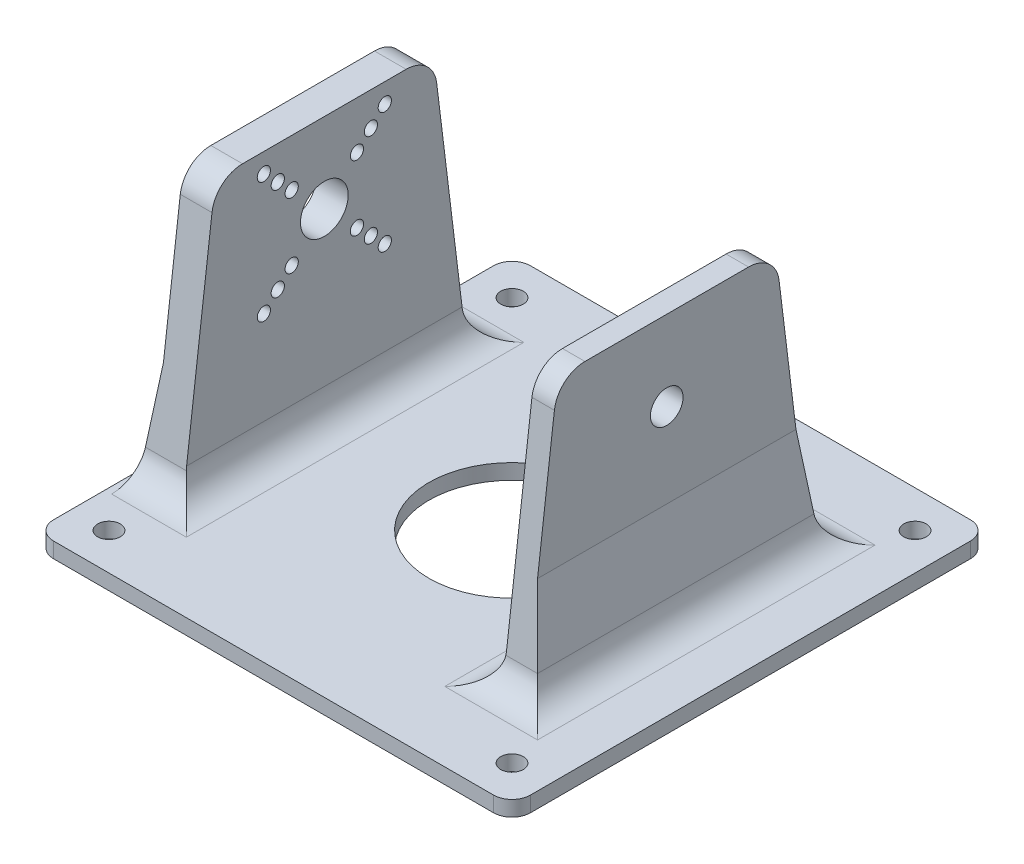
from build123d import *

# Parameters (mm, degrees)
SKETCH1_W           = 77.5
SKETCH1_H           = 77.5
SKETCH1_R           = 1.83
SKETCH1_R_2         = 13.5
BOSS_EXTRUDE1_DEPTH = 2.5
FILLET1_R           = 3
SKETCH2_W           = 5.15
SKETCH2_H           = 32
SKETCH2_W_2         = 3.65
BOSS_EXTRUDE2_DEPTH = 43
SKETCH3_R           = 3.875
SKETCH3_R_2         = 1.075
CUT_EXTRUDE1_DEPTH  = 10
SKETCH4_R           = 2.65
CUT_EXTRUDE2_DEPTH  = 10
SKETCH5_R           = 3.875
SKETCH5_R_2         = 2.65
BOSS_EXTRUDE3_DEPTH = 1.5
CHAMFER1_SIZE       = 1.5
CHAMFER2_SIZE       = 57.010424996
CHAMFER2_SIZE_2     = 7
CHAMFER3_SIZE       = 2
CHAMFER3_SIZE2      = 16.288692856
FILLET2_R           = 5


# Some blends are built 0.0001 mm under size
with BuildPart() as part:
    # Sketch1 → Boss-Extrude1 (new body)
    with BuildSketch(Plane(origin=(0, 0, 0), x_dir=(1, 0, 0), z_dir=(0, 1, 0))):
        Rectangle(SKETCH1_W, SKETCH1_H)
        with Locations(Location((32.75, 32.75, 0), (0, 0, 270))):
            Circle(SKETCH1_R, mode=Mode.SUBTRACT)
        with Locations(Location((32.75, -32.75, 0), (0, 0, 270))):
            Circle(SKETCH1_R, mode=Mode.SUBTRACT)
        with Locations(Location((-32.75, -32.75, 0), (0, 0, 270))):
            Circle(SKETCH1_R, mode=Mode.SUBTRACT)
        with Locations(Location((-32.75, 32.75, 0), (0, 0, 270))):
            Circle(SKETCH1_R, mode=Mode.SUBTRACT)
        with Locations(Location((0, 0, 0), (0, 0, 270))):
            Circle(SKETCH1_R_2, mode=Mode.SUBTRACT)
    extrude(amount=BOSS_EXTRUDE1_DEPTH)

    # Fillet1
    fillet1_edges = [part.edges().sort_by_distance(p)[0] for p in [
        (38.75, 1.25, 38.75),
        (-38.75, 1.25, 38.75),
        (-38.75, 1.25, -38.75),
        (38.75, 1.25, -38.75),
    ]]
    fillet(fillet1_edges, radius=FILLET1_R)

    # Sketch2 → Boss-Extrude2 (add)
    with BuildSketch(Plane(origin=(0, 2.5, 0), x_dir=(1, 0, 0), z_dir=(0, 1, 0))):
        with Locations((-33.075, 0)):
            Rectangle(SKETCH2_W, SKETCH2_H)
        with Locations((23.325, 0)):
            Rectangle(SKETCH2_W_2, SKETCH2_H)
    extrude(amount=BOSS_EXTRUDE2_DEPTH)

    # Sketch3 → Cut-Extrude1 (cut)
    with BuildSketch(Plane.ZY.offset(35.65)):
        with Locations((0, 32.5)):
            Circle(SKETCH3_R)
        with Locations((-5.303300859, 37.803300859)):
            Circle(SKETCH3_R_2)
        with Locations((5.303300859, 37.803300859)):
            Circle(SKETCH3_R_2)
        with Locations((5.303300859, 27.196699141)):
            Circle(SKETCH3_R_2)
        with Locations((-5.303300859, 27.196699141)):
            Circle(SKETCH3_R_2)
        with Locations((-7.566042559, 40.066042559)):
            Circle(SKETCH3_R_2)
        with Locations((-9.828784258, 42.328784258)):
            Circle(SKETCH3_R_2)
        with Locations((9.828784258, 42.328784258)):
            Circle(SKETCH3_R_2)
        with Locations((7.566042559, 40.066042559)):
            Circle(SKETCH3_R_2)
        with Locations((9.828784258, 22.671215742)):
            Circle(SKETCH3_R_2)
        with Locations((7.566042559, 24.933957441)):
            Circle(SKETCH3_R_2)
        with Locations((-9.828784258, 22.671215742)):
            Circle(SKETCH3_R_2)
        with Locations((-7.566042559, 24.933957441)):
            Circle(SKETCH3_R_2)
    extrude(amount=-CUT_EXTRUDE1_DEPTH, mode=Mode.SUBTRACT)

    # Sketch4 → Cut-Extrude2 (cut)
    with BuildSketch(Plane(origin=(25.15, 0, 0), x_dir=(0, 0, -1), z_dir=(1, 0, 0))):
        with Locations((0, 32.5)):
            Circle(SKETCH4_R)
    extrude(amount=-CUT_EXTRUDE2_DEPTH, mode=Mode.SUBTRACT)

    # Sketch5 → Boss-Extrude3 (add)
    with BuildSketch(Plane.ZY.offset(-21.5)):
        with Locations((0, 32.5)):
            Circle(SKETCH5_R)
        with Locations(Location((0, 32.5, 0), (0, 0, 180))):
            Circle(SKETCH5_R_2, mode=Mode.SUBTRACT)
    extrude(amount=BOSS_EXTRUDE3_DEPTH)

    # Chamfer1
    chamfer1_edges = [part.edges().sort_by_distance(p)[0] for p in [
        (21.5, 32.5, -3.875),
    ]]
    chamfer(chamfer1_edges, length=CHAMFER1_SIZE - 0.0001)  # a hair under: the kernel refuses the full size

    # Chamfer2
    # the kernel refuses this chamfer: 57.010424996, 7 mm, written as the material it adds along each edge
    with BuildSketch(Plane(origin=(25.15, 2.5, 16), x_dir=(0, 0.9999890085715016, -0.004688575069790725), z_dir=(-1, 0, 0))) as chamfer2_piece_1_section:
        Polygon((CHAMFER2_SIZE * 0.999989008568, -CHAMFER2_SIZE * 0.00468857506978), (-CHAMFER2_SIZE_2 * 0.00468857506979, -CHAMFER2_SIZE_2 * 0.999989008572), (0, 0), align=None)
    chamfer2_piece_1 = extrude(amount=3.65, mode=Mode.PRIVATE)
    chamfer2_piece_1 = split(chamfer2_piece_1, bisect_by=Plane(origin=(23.325, 45.5, 17.927649929), z_dir=(0, -1, 0)), keep=Keep.TOP, mode=Mode.PRIVATE)
    add(chamfer2_piece_1)
    with BuildSketch(Plane(origin=(25.15, 2.5, 16), x_dir=(0, 0.9999890085715016, -0.004688575069790725), z_dir=(-1, 0, 0))) as chamfer2_piece_2_section:
        Polygon((CHAMFER2_SIZE * 0.999989008568, -CHAMFER2_SIZE * 0.00468857506978), (-CHAMFER2_SIZE_2 * 0.00468857506979, -CHAMFER2_SIZE_2 * 0.999989008572), (0, 0), align=None)
    chamfer2_piece_2 = extrude(amount=151.836239061, mode=Mode.PRIVATE)
    chamfer2_piece_2 = split(chamfer2_piece_2, bisect_by=Plane(origin=(-33.075, 45.5, 17.927649929), z_dir=(0, -1, 0)), keep=Keep.TOP, mode=Mode.PRIVATE)
    chamfer2_piece_2 = split(chamfer2_piece_2, bisect_by=Plane(origin=(-35.65, 19.754331074, 17.927649929), z_dir=(1, 0, 0)), keep=Keep.TOP, mode=Mode.PRIVATE)
    chamfer2_piece_2 = split(chamfer2_piece_2, bisect_by=Plane(origin=(-30.5, 19.754331074, 17.927649929), z_dir=(-1, 0, 0)), keep=Keep.TOP, mode=Mode.PRIVATE)
    add(chamfer2_piece_2)
    with BuildSketch(Plane(origin=(117.686239061, 2.5, 16), x_dir=(0, -0.29696840376136574, 0.9548873060039212), z_dir=(-1, 0, 0))) as chamfer2_piece_3_section:
        Polygon((CHAMFER2_SIZE_2 * 0.954887306004, CHAMFER2_SIZE_2 * 0.296968403761), (-CHAMFER2_SIZE * 0.29696840376, CHAMFER2_SIZE * 0.954887306001), (0, 0), align=None)
    chamfer2_piece_3 = extrude(amount=153.336239061, mode=Mode.PRIVATE)
    chamfer2_piece_3 = split(chamfer2_piece_3, bisect_by=Plane(origin=(21.5, 19.754331074, 17.927649929), z_dir=(1, 0, 0)), keep=Keep.TOP, mode=Mode.PRIVATE)
    chamfer2_piece_3 = split(chamfer2_piece_3, bisect_by=Plane(origin=(25.15, 19.754331074, 17.927649929), z_dir=(-1, 0, 0)), keep=Keep.TOP, mode=Mode.PRIVATE)
    chamfer2_piece_3 = split(chamfer2_piece_3, bisect_by=Plane(origin=(23.325, 45.5, 17.927649929), z_dir=(0, -1, 0)), keep=Keep.TOP, mode=Mode.PRIVATE)
    add(chamfer2_piece_3)
    with BuildSketch(Plane(origin=(-30.5, 2.5, 16), x_dir=(0, -0.29696840376136574, 0.9548873060039212), z_dir=(-1, 0, 0))) as chamfer2_piece_4_section:
        Polygon((CHAMFER2_SIZE_2 * 0.954887306004, CHAMFER2_SIZE_2 * 0.296968403761), (-CHAMFER2_SIZE * 0.29696840376, CHAMFER2_SIZE * 0.954887306001), (0, 0), align=None)
    chamfer2_piece_4 = extrude(amount=5.15, mode=Mode.PRIVATE)
    chamfer2_piece_4 = split(chamfer2_piece_4, bisect_by=Plane(origin=(-33.075, 45.5, 17.927649929), z_dir=(0, -1, 0)), keep=Keep.TOP, mode=Mode.PRIVATE)
    add(chamfer2_piece_4)
    with BuildSketch(Plane(origin=(-35.65, 2.5, -16), x_dir=(0, -0.29696840376136574, -0.9548873060039212), z_dir=(1, 0, 0))) as chamfer2_piece_5_section:
        Polygon((CHAMFER2_SIZE_2 * 0.954887306004, CHAMFER2_SIZE_2 * 0.296968403761), (-CHAMFER2_SIZE * 0.29696840376, CHAMFER2_SIZE * 0.954887306001), (0, 0), align=None)
    chamfer2_piece_5 = extrude(amount=5.15, mode=Mode.PRIVATE)
    chamfer2_piece_5 = split(chamfer2_piece_5, bisect_by=Plane(origin=(-33.075, 45.5, -17.927649929), z_dir=(0, -1, 0)), keep=Keep.TOP, mode=Mode.PRIVATE)
    add(chamfer2_piece_5)
    with BuildSketch(Plane(origin=(-35.65, 2.5, -16), x_dir=(0, -0.29696840376136574, -0.9548873060039212), z_dir=(1, 0, 0))) as chamfer2_piece_6_section:
        Polygon((CHAMFER2_SIZE_2 * 0.954887306004, CHAMFER2_SIZE_2 * 0.296968403761), (-CHAMFER2_SIZE * 0.29696840376, CHAMFER2_SIZE * 0.954887306001), (0, 0), align=None)
    chamfer2_piece_6 = extrude(amount=153.336239061, mode=Mode.PRIVATE)
    chamfer2_piece_6 = split(chamfer2_piece_6, bisect_by=Plane(origin=(21.5, 19.754331074, -17.927649929), z_dir=(1, 0, 0)), keep=Keep.TOP, mode=Mode.PRIVATE)
    chamfer2_piece_6 = split(chamfer2_piece_6, bisect_by=Plane(origin=(23.325, 45.5, -17.927649929), z_dir=(0, -1, 0)), keep=Keep.TOP, mode=Mode.PRIVATE)
    chamfer2_piece_6 = split(chamfer2_piece_6, bisect_by=Plane(origin=(25.15, 19.754331074, -17.927649929), z_dir=(-1, 0, 0)), keep=Keep.TOP, mode=Mode.PRIVATE)
    add(chamfer2_piece_6)
    with BuildSketch(Plane(origin=(-126.686239061, 2.5, -16), x_dir=(0, -0.29696840376136574, -0.9548873060039212), z_dir=(1, 0, 0))) as chamfer2_piece_7_section:
        Polygon((CHAMFER2_SIZE_2 * 0.954887306004, CHAMFER2_SIZE_2 * 0.296968403761), (-CHAMFER2_SIZE * 0.29696840376, CHAMFER2_SIZE * 0.954887306001), (0, 0), align=None)
    chamfer2_piece_7 = extrude(amount=151.836239061, mode=Mode.PRIVATE)
    chamfer2_piece_7 = split(chamfer2_piece_7, bisect_by=Plane(origin=(-33.075, 45.5, -17.927649929), z_dir=(0, -1, 0)), keep=Keep.TOP, mode=Mode.PRIVATE)
    chamfer2_piece_7 = split(chamfer2_piece_7, bisect_by=Plane(origin=(-35.65, 19.754331074, -17.927649929), z_dir=(1, 0, 0)), keep=Keep.TOP, mode=Mode.PRIVATE)
    chamfer2_piece_7 = split(chamfer2_piece_7, bisect_by=Plane(origin=(-30.5, 19.754331074, -17.927649929), z_dir=(-1, 0, 0)), keep=Keep.TOP, mode=Mode.PRIVATE)
    add(chamfer2_piece_7)
    with BuildSketch(Plane(origin=(21.5, 2.5, -16), x_dir=(0, -0.29696840376136574, -0.9548873060039212), z_dir=(1, 0, 0))) as chamfer2_piece_8_section:
        Polygon((CHAMFER2_SIZE_2 * 0.954887306004, CHAMFER2_SIZE_2 * 0.296968403761), (-CHAMFER2_SIZE * 0.29696840376, CHAMFER2_SIZE * 0.954887306001), (0, 0), align=None)
    chamfer2_piece_8 = extrude(amount=3.65, mode=Mode.PRIVATE)
    chamfer2_piece_8 = split(chamfer2_piece_8, bisect_by=Plane(origin=(23.325, 45.5, -17.927649929), z_dir=(0, -1, 0)), keep=Keep.TOP, mode=Mode.PRIVATE)
    add(chamfer2_piece_8)

    # Chamfer3
    chamfer3_edges = [part.edges().sort_by_distance(p)[0] for p in [
        (-35.65, 2.5, 0),
        (25.15, 2.5, 0),
    ]]
    chamfer3_side = [part.faces().sort_by_distance(p)[0] for p in [
        (0, 2.5, 37.653984489),
    ]]
    chamfer(chamfer3_edges, length=CHAMFER3_SIZE, length2=CHAMFER3_SIZE2, reference=chamfer3_side[0])

    # Fillet2
    fillet2_edges = [part.edges().sort_by_distance(p)[0] for p in [
        (24.325, 2.5, -23),
        (-34.075, 2.5, -23),
        (-34.075, 2.5, 23),
        (24.325, 2.5, 23),
        (23.325, 45.5, 17.720263881),
        (-33.075, 45.5, 17.720263881),
        (-33.075, 45.5, -17.720263881),
        (23.325, 45.5, -17.720263881),
        (27.15, 2.5, 0),
        (-30.5, 2.5, 0),
        (21.5, 2.5, 0),
    ]]
    fillet(fillet2_edges, radius=FILLET2_R)


solid = part.part
